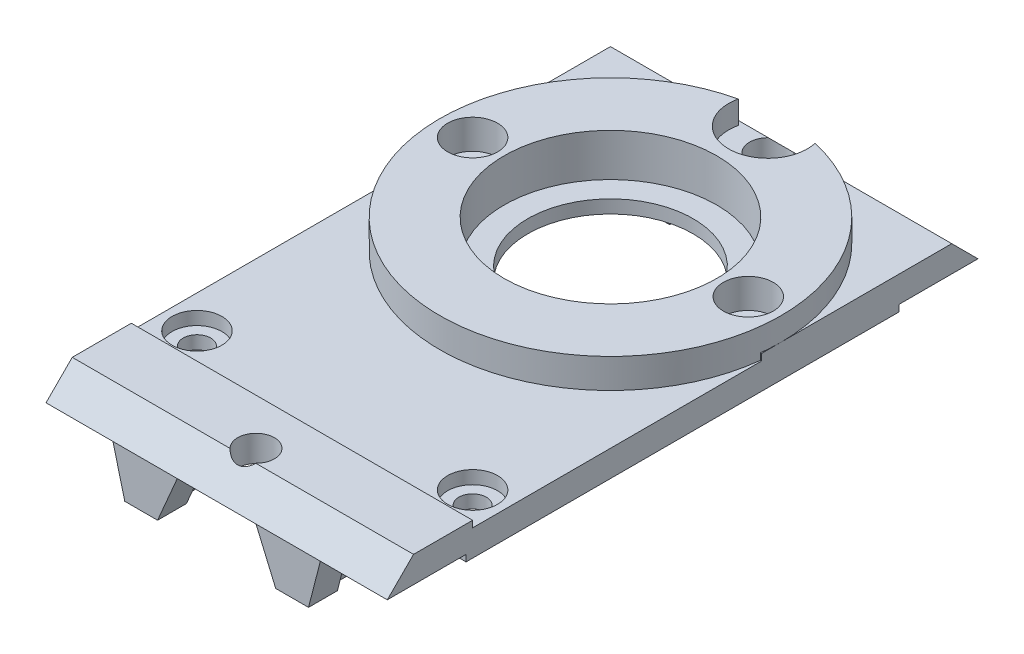
from build123d import *

# Parameters (mm, degrees)
SKETCH_1_W                   = 26
SKETCH_1_H                   = 45
EXTRUDE_1_DEPTH              = 2
EXTRUDE_3_DEPTH              = 6
CUT_EXTRUDE_1_REACH          = 28.561
SKETCH_5_R                   = 1.4
EXTRUDE_4_REACH              = 36.562
SKETCH_6_W                   = 33
SKETCH_6_H                   = 0.5
CUT_EXTRUDE_2_REACH          = 36.562
SKETCH_7_W                   = 22
SKETCH_7_H                   = 0.5
HOLE_WIZARD_M2_1_D           = 2.1
HOLE_WIZARD_M2_1_CBORE_D     = 3.8
HOLE_WIZARD_M2_1_CBORE_DEPTH = 1
CHAMFER_1_SIZE               = 2
EXTRUDE_5_DEPTH              = 2.25
HOLE_WIZARD_M2_2_D           = 2.1
HOLE_WIZARD_M2_2_CBORE_D     = 3.8
HOLE_WIZARD_M2_2_CBORE_DEPTH = 2.25
HOLE_WIZARD_M2_3_D           = 12.6
HOLE_WIZARD_M2_3_CBORE_D     = 16.2
HOLE_WIZARD_M2_3_CBORE_DEPTH = 3.25
CUT_EXTRUDE_3_DEPTH          = 0.8
MIRROR_4_COPY_1_DEPTH        = 0.8


with BuildPart() as part:
    # ｽｹｯﾁ1 → ﾎﾞｽ - 押し出し1 (new body)
    with BuildSketch(Plane(origin=(0, 0, 0), x_dir=(1, 0, 0), z_dir=(0, 1, 0))):
        Rectangle(SKETCH_1_W, SKETCH_1_H)
    extrude(amount=EXTRUDE_1_DEPTH)

    # ｽｹｯﾁ4 → ﾎﾞｽ - 押し出し3 (add)
    with BuildSketch(Plane.XY.offset(22.5)):
        Polygon((-7, -3.5), (-4.5, -3.5), (-3, 0), (-7.9, 0), align=None)
        Polygon((3, 0), (4.5, -3.5), (7, -3.5), (7.9, 0), align=None)
    extrude_3 = extrude(amount=-EXTRUDE_3_DEPTH)

    # ｽｹｯﾁ5 → ｶｯﾄ - 押し出し1 (cut, up to next)
    with BuildSketch(Plane(origin=(0, 2, 0), x_dir=(1, 0, 0), z_dir=(0, 1, 0)), mode=Mode.PRIVATE) as cut_extrude_1_sk1:
        with Locations(Location((0, -19.5, 0), (0, 0, 270))):
            Circle(SKETCH_5_R)
    cut_extrude_1_tool1 = extrude(cut_extrude_1_sk1.sketch, amount=-CUT_EXTRUDE_1_REACH, mode=Mode.PRIVATE) & part.part
    cut_extrude_1 = cut_extrude_1_tool1.solids().sort_by_distance((0, 2, 19.5))[0]
    add(cut_extrude_1, mode=Mode.SUBTRACT)

    # ﾎﾞｽ - 押し出し4: up to this face of the body (flat: up to its plane)
    extrude_4_end = Plane(part.part.faces().sort_by_distance((-13, 1, 0))[0])
    # ｽｹｯﾁ6 → ﾎﾞｽ - 押し出し4 (add, up to the picked face)
    with BuildSketch(Plane(origin=(13, 0, 0), x_dir=(0, 0, -1), z_dir=(1, 0, 0)), mode=Mode.PRIVATE) as extrude_4_sk1:
        with Locations((0, -0.25)):
            Rectangle(SKETCH_6_W, SKETCH_6_H)
    extrude_4_tool1 = split(extrude(extrude_4_sk1.sketch, amount=-EXTRUDE_4_REACH, mode=Mode.PRIVATE), bisect_by=extrude_4_end, keep=Keep.BOTH, mode=Mode.PRIVATE)
    add(extrude_4_tool1.solids().sort_by(Axis((13, -0.25, 0), (-1, 0, 0)))[0])

    # ｽｹｯﾁ7 → ｶｯﾄ - 押し出し2 (cut, up to next)
    with BuildSketch(Plane(origin=(13, 0, 0), x_dir=(0, 0, -1), z_dir=(1, 0, 0)), mode=Mode.PRIVATE) as cut_extrude_2_sk1:
        with Locations((-5, 1.75)):
            Rectangle(SKETCH_7_W, SKETCH_7_H)
    cut_extrude_2_tool1 = extrude(cut_extrude_2_sk1.sketch, amount=-CUT_EXTRUDE_2_REACH, mode=Mode.PRIVATE) & part.part
    add(cut_extrude_2_tool1.solids().sort_by_distance((13, 1.75, 5))[0], mode=Mode.SUBTRACT)

    # M2 丸平ねじ用座ぐり穴1 (through all)
    with Locations(Plane(origin=(0, 1.5, 0), x_dir=(1, 0, 0), z_dir=(0, 1, 0))):
        with Locations((10.5, -13.5)):
            hole_wizard_m2_1 = CounterBoreHole(HOLE_WIZARD_M2_1_D / 2, HOLE_WIZARD_M2_1_CBORE_D / 2, HOLE_WIZARD_M2_1_CBORE_DEPTH)

    # 面取り1
    # the kernel refuses this chamfer: 2 mm, written as the material it takes off along each edge
    with BuildSketch(Plane(origin=(18.143365976, 2, 22.5), x_dir=(0, 0.027495876610586296, -0.9996219169112968), z_dir=(-1, 0, 0))) as chamfer_1_piece_1:
        Polygon((CHAMFER_1_SIZE * 0.999621916911, CHAMFER_1_SIZE * 0.0274958766106), (-CHAMFER_1_SIZE * 0.0274958766106, CHAMFER_1_SIZE * 0.999621916911), (0, 0), align=None)
    extrude(amount=36.286731952, mode=Mode.SUBTRACT)
    with BuildSketch(Plane(origin=(-18.143365976, 2, -22.5), x_dir=(0, -0.9996219169112968, -0.02749587661058563), z_dir=(1, 0, 0))) as chamfer_1_piece_2:
        Polygon((CHAMFER_1_SIZE * 0.999621916911, -CHAMFER_1_SIZE * 0.0274958766106), (-CHAMFER_1_SIZE * 0.0274958766106, -CHAMFER_1_SIZE * 0.999621916911), (0, 0), align=None)
    extrude(amount=36.286731952, mode=Mode.SUBTRACT)

    # ﾐﾗｰ1: ﾎﾞｽ - 押し出し3, ｶｯﾄ - 押し出し1 across plane
    add(extrude_3.mirror(Plane.XY))
    add(cut_extrude_1.mirror(Plane.XY), mode=Mode.SUBTRACT)

    # ｽｹｯﾁ11 → ﾎﾞｽ - 押し出し5 (add)
    with BuildSketch(Plane(origin=(0, 1.5, 0), x_dir=(1, 0, 0), z_dir=(0, 1, 0))):
        with BuildLine():
            ThreePointArc((-2.924988129, 20.166666667), (0, -5.5), (2.924988129, 20.166666667))
            ThreePointArc((2.924988129, 20.166666667), (0, 16.5), (-2.924988129, 20.166666667))
        make_face()
    extrude(amount=EXTRUDE_5_DEPTH)

    # M2 丸平ねじ用座ぐり穴2 (through all)
    with Locations(Plane(origin=(0, 3.75, 0), x_dir=(1, 0, 0), z_dir=(0, 1, 0))):
        with Locations((10.5, 7.5)):
            hole_wizard_m2_2 = CounterBoreHole(HOLE_WIZARD_M2_2_D / 2, HOLE_WIZARD_M2_2_CBORE_D / 2, HOLE_WIZARD_M2_2_CBORE_DEPTH)

    # M2 丸平ねじ用座ぐり穴3 (through all)
    with Locations(Plane(origin=(0, 3.75, 0), x_dir=(1, 0, 0), z_dir=(0, 1, 0))):
        with Locations((0, 7.5)):
            CounterBoreHole(HOLE_WIZARD_M2_3_D / 2, HOLE_WIZARD_M2_3_CBORE_D / 2, HOLE_WIZARD_M2_3_CBORE_DEPTH)

    # ﾐﾗｰ2: M2 丸平ねじ用座ぐり穴1, M2 丸平ねじ用座ぐり穴2 across plane
    add(hole_wizard_m2_1.mirror(Plane(origin=(0, 0, 0), x_dir=(0, 0, 1), z_dir=(1, 0, 0))), mode=Mode.SUBTRACT)
    add(hole_wizard_m2_2.mirror(Plane(origin=(0, 0, 0), x_dir=(0, 0, 1), z_dir=(1, 0, 0))), mode=Mode.SUBTRACT)

    # ｽｹｯﾁ17 → ｶｯﾄ - 押し出し3 (cut, symmetric)
    with BuildSketch(Plane.XY.offset(19.5)):
        Polygon((4.5, -3.5), (3, 0), (3.6, 0), (5.1, -3.5), align=None)
        Polygon((6.4, -3.5), (7, -3.5), (7.9, 0), (7.3, 0), align=None)
    cut_extrude_3 = extrude(amount=CUT_EXTRUDE_3_DEPTH, both=True, mode=Mode.SUBTRACT)

    # ﾐﾗｰ3: ｶｯﾄ - 押し出し3 across plane
    add(cut_extrude_3.mirror(Plane(origin=(0, 0, 0), x_dir=(0, 0, 1), z_dir=(1, 0, 0))), mode=Mode.SUBTRACT)

    # ﾐﾗｰ4: ｶｯﾄ - 押し出し3 across plane
    add(cut_extrude_3.mirror(Plane.XY), mode=Mode.SUBTRACT)

    # ﾐﾗｰ4 copy 1 sketch → ﾐﾗｰ4 copy 1 (cut, symmetric)
    with BuildSketch(Plane(origin=(0, 0, -19.5), x_dir=(-1, 0, 0), z_dir=(0, 0, -1))):
        Polygon((4.5, -3.5), (3, 0), (3.6, 0), (5.1, -3.5), align=None)
        Polygon((6.4, -3.5), (7, -3.5), (7.9, 0), (7.3, 0), align=None)
    extrude(amount=MIRROR_4_COPY_1_DEPTH, both=True, mode=Mode.SUBTRACT)


solid = part.part
